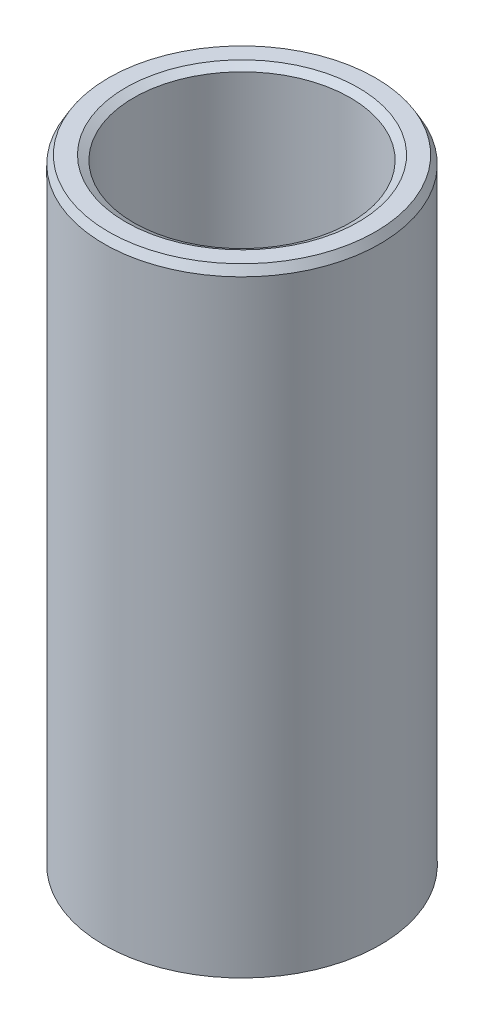
from build123d import *
from OCP.BRepFilletAPI import BRepFilletAPI_MakeChamfer

# Parameters (mm, degrees)
SKETCH1_R           = 37.5
BOSS_EXTRUDE1_DEPTH = 168.357929233
SKETCH2_R           = 29.408283072
CUT_EXTRUDE1_DEPTH  = 177.513150603
CHAMFER1_SIZE       = 2.193001489
CHAMFER1_SIZE2      = 1.26613


with BuildPart() as part:
    # Sketch1 → Boss-Extrude1 (new body)
    with BuildSketch(Plane(origin=(0, 0, 0), x_dir=(1, 0, 0), z_dir=(0, 1, 0))):
        Circle(SKETCH1_R)
    extrude(amount=BOSS_EXTRUDE1_DEPTH)

    # Sketch2 → Cut-Extrude1 (cut, through all)
    with BuildSketch(Plane(origin=(0, 0, 0), x_dir=(1, 0, 0), z_dir=(0, 1, 0))):
        Circle(SKETCH2_R)
    extrude(amount=CUT_EXTRUDE1_DEPTH, mode=Mode.SUBTRACT)

    # Chamfer1: one chamfer whose edges measure the first distance from different faces: ONE call of the kernel's chamfer builder (chamfer() names one face for all edges)
    chamfer1_edges_1 = [part.edges().sort_by_distance(p)[0] for p in [
        (-29.408283072, 168.357929233, 0),
    ]]
    chamfer1_side_1 = [part.faces().sort_by_distance(p)[0] for p in [
        (-36.439339828, 168.357929233, 0),
    ]]
    chamfer1_edges_2 = [part.edges().sort_by_distance(p)[0] for p in [
        (-29.408283072, 0, 0),
    ]]
    chamfer1_side_2 = [part.faces().sort_by_distance(p)[0] for p in [
        (-29.408283072, 84.178964617, 0),
    ]]
    chamfer1_edges_3 = [part.edges().sort_by_distance(p)[0] for p in [
        (-37.5, 0, 0),
    ]]
    chamfer1_side_3 = [part.faces().sort_by_distance(p)[0] for p in [
        (-36.439339828, 0, 0),
    ]]
    chamfer1_edges_4 = [part.edges().sort_by_distance(p)[0] for p in [
        (-37.5, 168.357929233, 0),
    ]]
    chamfer1_side_4 = [part.faces().sort_by_distance(p)[0] for p in [
        (-37.5, 84.178964617, 0),
    ]]
    chamfer1 = BRepFilletAPI_MakeChamfer(part.part.solid().wrapped)
    for e in chamfer1_edges_1:
        chamfer1.Add(CHAMFER1_SIZE, CHAMFER1_SIZE2, e.wrapped, chamfer1_side_1[0].wrapped)  # the first distance lies on this face
    for e in chamfer1_edges_2:
        chamfer1.Add(CHAMFER1_SIZE, CHAMFER1_SIZE2, e.wrapped, chamfer1_side_2[0].wrapped)  # the first distance lies on this face
    for e in chamfer1_edges_3:
        chamfer1.Add(CHAMFER1_SIZE, CHAMFER1_SIZE2, e.wrapped, chamfer1_side_3[0].wrapped)  # the first distance lies on this face
    for e in chamfer1_edges_4:
        chamfer1.Add(CHAMFER1_SIZE, CHAMFER1_SIZE2, e.wrapped, chamfer1_side_4[0].wrapped)  # the first distance lies on this face
    add(Compound.cast(chamfer1.Shape()), mode=Mode.REPLACE)


solid = part.part
